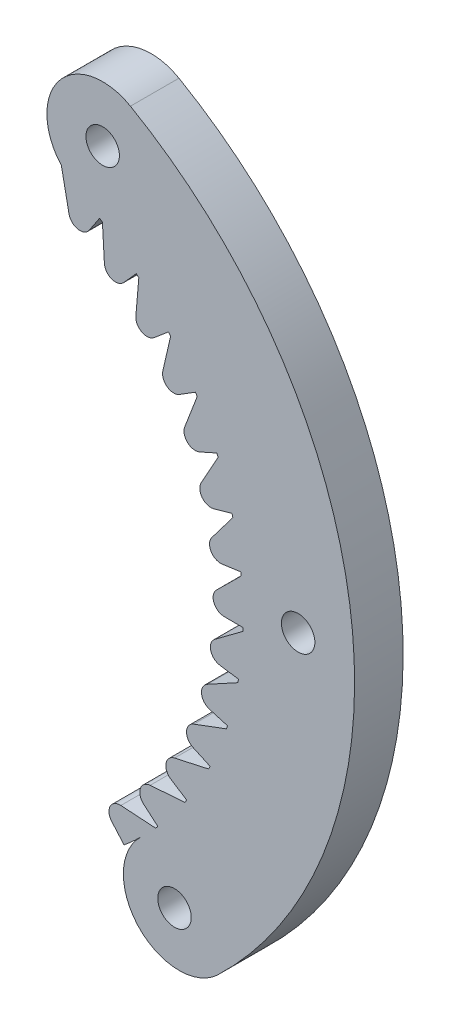
from build123d import *

# Parameters (mm, degrees)
BOSS_EXTRU_1_DEPTH      = 4.35
ENL_V_MAT_EXTRU_1_DEPTH = 38.269393438
CONG_3_R                = 5
ESQUISSE3_R             = 1.5
ENL_V_MAT_EXTRU_2_DEPTH = 38.269393579
BOSS_EXTRU_2_DEPTH      = 4.35


with BuildPart() as part:
    # Esquisse1 → Boss.-Extru.1 (new body)
    with BuildSketch(Plane.XY):
        with BuildLine():
            Line((-13.183298291, -31.679408844), (-0.713739606, -32.039150948))
            ThreePointArc((-0.713739606, -32.039150948), (13.826896651, 2.211449904), (-6.128687986, 33.616997237))
            ThreePointArc((-6.128687986, 33.616997237), (-12.95399094, 31.768960554), (-11.105954257, 24.9436576))
            ThreePointArc((-11.105954257, 24.9436576), (3.84132079, 1.61453914), (-6.69721834, -24.00982412))
            ThreePointArc((-6.69721834, -24.00982412), (-10.263527106, -27.571231769), (-13.183298291, -31.679408844))
        make_face()
    extrude(amount=BOSS_EXTRU_1_DEPTH)

    # Esquisse2 → Enlèv. mat.-Extru.1 (cut, through all)
    with BuildSketch(Plane(origin=(0, 0, 0), x_dir=(-1, 0, 0), z_dir=(0, 0, -1))):
        with BuildLine():
            Line((13.183298291, -31.679408844), (0.713739606, -32.039150948))
            ThreePointArc((0.713739606, -32.039150948), (5.648573529, -29.472487497), (6.69721834, -24.00982412))
            ThreePointArc((6.69721834, -24.00982412), (10.263527106, -27.571231769), (13.183298291, -31.679408844))
        make_face()
    extrude(amount=-ENL_V_MAT_EXTRU_1_DEPTH, mode=Mode.SUBTRACT)

    # Congé3
    cong_3_edges = [part.edges().sort_by_distance(p)[0] for p in [
        (-0.713739606, -32.039150948, 2.175),
        (-6.69721834, -24.00982412, 2.175),
    ]]
    fillet(cong_3_edges, radius=CONG_3_R - 0.0001)  # a hair under: the kernel refuses the full size

    # Esquisse3 → Enlèv. mat.-Extru.2 (cut, through all)
    with BuildSketch(Plane.XY.offset(4.35)):
        with Locations((-8.617321121, 29.280327419)):
            Circle(ESQUISSE3_R)
        with Locations((8.901780596, 0.257662949)):
            Circle(ESQUISSE3_R)
        with Locations((-2.180082362, -26.639815256)):
            Circle(ESQUISSE3_R)
    extrude(amount=-ENL_V_MAT_EXTRU_2_DEPTH, mode=Mode.SUBTRACT)

    # Esquisse4 → Boss.-Extru.2 (add, through all)
    with BuildSketch(Plane.XY.offset(4.35)):
        with BuildLine():
            Line((-9.822535933, 22.144666991), (-8.891427789, 23.540777623))
            ThreePointArc((-8.891427789, 23.540777623), (-9.983360232, 24.266418144), (-11.105954257, 24.9436576))
            ThreePointArc((-11.105954257, 24.9436576), (-11.749605725, 25.383047193), (-12.317161418, 25.917117378))
            Line((-12.317161418, 25.917117378), (-12.247003841, 25.565996611))
            Line((-12.247003841, 25.565996611), (-11.635101494, 22.503581534))
            ThreePointArc((-11.635101494, 22.503581534), (-10.848728229, 21.718565469), (-9.822535933, 22.144666991))
        make_face()
        with BuildLine():
            Line((-6.720773728, 19.63604394), (-5.602744878, 20.887482618))
            ThreePointArc((-5.602744878, 20.887482618), (-7.081127932, 22.175442131), (-8.640486445, 23.364078822))
            Line((-8.640486445, 23.364078822), (-8.464930853, 20.246068108))
            ThreePointArc((-8.464930853, 20.246068108), (-7.796654849, 19.358351758), (-6.720773728, 19.63604394))
        make_face()
        with BuildLine():
            Line((-4.002247722, 16.716500355), (-2.719479126, 17.798439356))
            ThreePointArc((-2.719479126, 17.798439356), (-4.002235611, 19.281339204), (-5.379119408, 20.677278733))
            Line((-5.379119408, 20.677278733), (-5.643393478, 17.565531668))
            ThreePointArc((-5.643393478, 17.565531668), (-5.106472893, 16.592726743), (-4.002247722, 16.716500355))
        make_face()
        with BuildLine():
            Line((-1.720891689, 13.443958065), (-0.298832635, 14.33493243))
            ThreePointArc((-0.298832635, 14.33493243), (-1.360513504, 15.983352852), (-2.527606113, 17.558900694))
            Line((-2.527606113, 17.558900694), (-3.22646682, 14.515152299))
            ThreePointArc((-3.22646682, 14.515152299), (-2.831553807, 13.476558611), (-1.720891689, 13.443958065))
        make_face()
        with BuildLine():
            Line((0.078033764, 9.883342162), (1.611170559, 10.565675544))
            ThreePointArc((1.611170559, 10.565675544), (0.791628357, 12.346912961), (-0.142518712, 14.07081128))
            Line((-0.142518712, 14.07081128), (-1.262101119, 11.155447526))
            ThreePointArc((-1.262101119, 11.155447526), (-1.017030492, 10.071670094), (0.078033764, 9.883342162))
        make_face()
        with BuildLine():
            Line((1.358839136, 6.105292932), (2.972637242, 6.565448283))
            ThreePointArc((2.972637242, 6.565448283), (2.411492888, 8.444164113), (1.728824224, 10.282211897))
            Line((1.728824224, 10.282211897), (0.210731898, 7.553071689))
            ThreePointArc((0.210731898, 7.553071689), (0.301098098, 6.445611945), (1.358839136, 6.105292932))
        make_face()
        with BuildLine():
            Line((2.096114089, 2.184764392), (3.758556811, 2.413612532))
            ThreePointArc((3.758556811, 2.413612532), (3.46694304, 4.352534286), (3.04929648, 6.268265872))
            Line((3.04929648, 6.268265872), (1.16281219, 3.779493562))
            ThreePointArc((1.16281219, 3.779493562), (1.096681157, 2.670322781), (2.096114089, 2.184764392))
        make_face()
        with BuildLine():
            Line((2.275231572, -1.800462743), (3.953337136, -1.807462011))
            ThreePointArc((3.953337136, -1.807462011), (3.937039374, 0.15319873), (3.792700751, 2.108607261))
            Line((3.792700751, 2.108607261), (1.575251109, -0.090421541))
            ThreePointArc((1.575251109, -0.090421541), (1.35393484, -1.179298138), (2.275231572, -1.800462743))
        make_face()
        with BuildLine():
            Line((0.955923809, -9.649040634), (2.565827278, -10.122641832))
            ThreePointArc((2.565827278, -10.122641832), (3.095663042, -8.234857357), (3.501051982, -6.316494523))
            Line((3.501051982, -6.316494523), (0.759343223, -7.811768298))
            ThreePointArc((0.759343223, -7.811768298), (0.243820453, -8.79607994), (0.955923809, -9.649040634))
        make_face()
        with BuildLine():
            Line((1.89263801, -5.771324181), (3.553113903, -6.014031995))
            ThreePointArc((3.553113903, -6.014031995), (3.812455487, -4.07053049), (3.944288385, -2.114239038))
            Line((3.944288385, -2.114239038), (1.439866137, -3.979897042))
            ThreePointArc((1.439866137, -3.979897042), (1.067755401, -5.026876858), (1.89263801, -5.771324181))
        make_face()
        with BuildLine():
            Line((-0.516327235, -13.356680753), (1.011064381, -14.051779397))
            ThreePointArc((1.011064381, -14.051779397), (1.80088273, -12.257164359), (2.471785062, -10.414789202))
            Line((2.471785062, -10.414789202), (-0.452816504, -11.510013499))
            ThreePointArc((-0.452816504, -11.510013499), (-1.101523675, -12.412128869), (-0.516327235, -13.356680753))
        make_face()
        with BuildLine():
            Line((-2.494906628, -16.820687389), (-1.080329313, -17.723493178))
            ThreePointArc((-1.080329313, -17.723493178), (-0.046197856, -16.057651562), (0.876907606, -14.327815597))
            Line((0.876907606, -14.327815597), (-2.172564591, -15.001261883))
            ThreePointArc((-2.172564591, -15.001261883), (-2.941586238, -15.803283605), (-2.494906628, -16.820687389))
        make_face()
        with BuildLine():
            Line((-4.940560652, -19.972336923), (-3.666861923, -21.064938782))
            ThreePointArc((-3.666861923, -21.064938782), (-2.40893385, -19.560919792), (-1.251939064, -17.977941831))
            Line((-1.251939064, -17.977941831), (-4.365782364, -18.216249374))
            ThreePointArc((-4.365782364, -18.216249374), (-5.239861602, -18.902265862), (-4.940560652, -19.972336923))
        make_face()
        with BuildLine():
            ThreePointArc((-5.229503112, -22.686931264), (-4.539706777, -22.000844712), (-3.872520027, -21.292751794))
            Line((-3.872520027, -21.292751794), (-6.988957821, -21.091192728))
            ThreePointArc((-6.988957821, -21.091192728), (-7.95075349, -21.647593865), (-7.804769136, -22.749102695))
            Line((-7.804769136, -22.749102695), (-6.69721834, -24.00982412))
            ThreePointArc((-6.69721834, -24.00982412), (-5.952466431, -23.360464628), (-5.229503112, -22.686931264))
        make_face()
    extrude(amount=-BOSS_EXTRU_2_DEPTH)


solid = part.part
